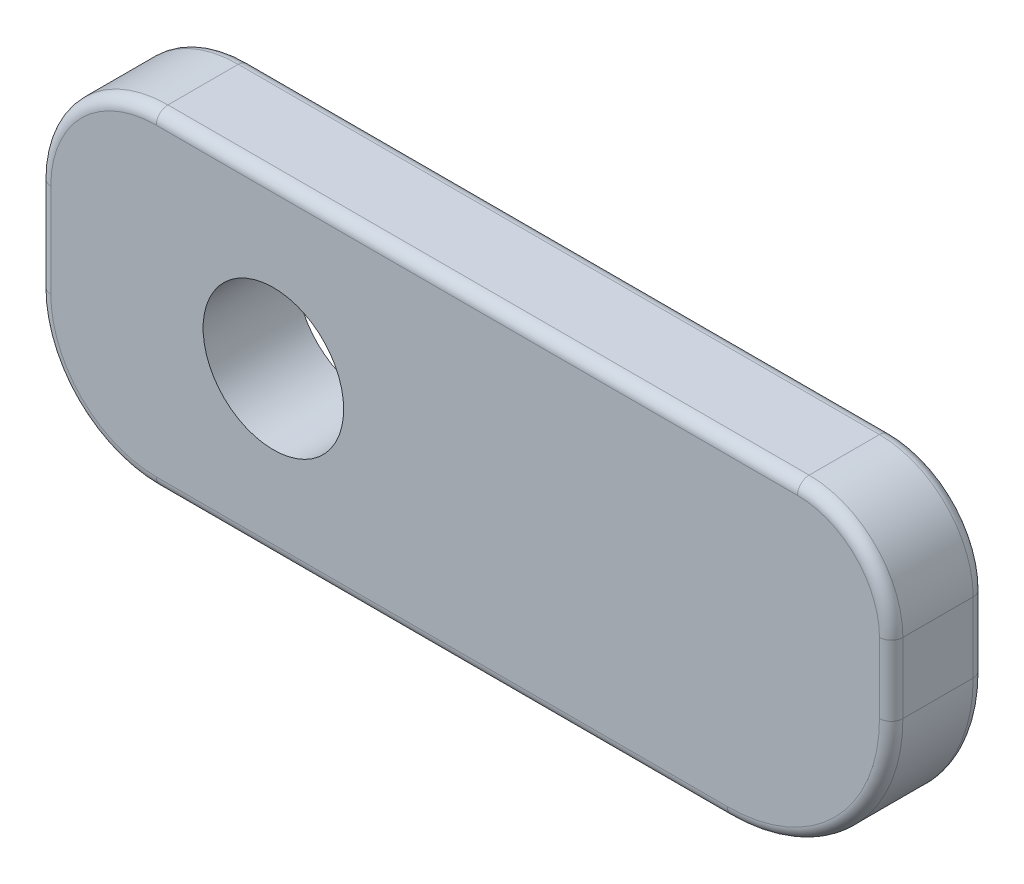
from build123d import *

# Parameters (mm, degrees)
SKETCH1_W           = 92.3798
SKETCH1_H           = 35.56
SKETCH1_R           = 7.62
BOSS_EXTRUDE1_DEPTH = 10.16
FILLET1_R           = 1.27
FILLET2_R           = 1.27
FILLET3_R           = 17.78
FILLET4_R           = 10.16
FILLET5_R           = 12.7
FILLET6_R           = 12.7


with BuildPart() as part:
    # Sketch1 → Boss-Extrude1 (new body)
    with BuildSketch(Plane.XY):
        with Locations((46.1899, 17.78)):
            Rectangle(SKETCH1_W, SKETCH1_H)
        with Locations((25.4, 17.78)):
            Circle(SKETCH1_R, mode=Mode.SUBTRACT)
    extrude(amount=BOSS_EXTRUDE1_DEPTH)

    # Fillet1
    fillet1_edges = [part.edges().sort_by_distance(p)[0] for p in [
        (46.1899, 35.56, 10.16),
        (0, 17.78, 10.16),
        (46.1899, 0, 10.16),
        (92.3798, 17.78, 10.16),
    ]]
    fillet(fillet1_edges, radius=FILLET1_R)

    # Fillet2
    fillet2_edges = [part.edges().sort_by_distance(p)[0] for p in [
        (0, 17.78, 0),
        (46.1899, 35.56, 0),
        (92.3798, 17.78, 0),
        (46.1899, 0, 0),
    ]]
    fillet(fillet2_edges, radius=FILLET2_R)

    # Fillet3
    # the kernel refuses this fillet: 17.78 mm, written as the material it takes off along each edge
    with BuildSketch(Plane(origin=(74.5998, 17.78, 10.16), x_dir=(0, -1, 0), z_dir=(-1, 0, 0))) as fillet3_piece_1:
        with BuildLine():
            CenterArc((16.51, -1.27), 1.27, 0, 90)
            Line((17.78, -1.27), (17.78, 0))
            Line((17.78, 0), (16.51, 0))
        make_face()
    revolve(axis=Axis((74.5998, 17.78, 10.16), (0, 0, 1)), revolution_arc=90, mode=Mode.SUBTRACT)
    with BuildSketch(Plane(origin=(74.5998, 17.78, 0), x_dir=(1, 0, 0), z_dir=(0, 1, 0))) as fillet3_piece_2:
        with BuildLine():
            CenterArc((16.51, -1.27), 1.27, 0, 90)
            Line((17.78, -1.27), (17.78, 0))
            Line((17.78, 0), (16.51, 0))
        make_face()
    revolve(axis=Axis((74.5998, 17.78, 0), (0, 0, -1)), revolution_arc=90, mode=Mode.SUBTRACT)
    with BuildSketch(Plane(origin=(92.3798, 0, 0), x_dir=(-1, 0, 0), z_dir=(0, 0, 1))) as fillet3_piece_3:
        with BuildLine():
            CenterArc((FILLET3_R, -FILLET3_R), FILLET3_R, 90, 90)
            Line((0, -FILLET3_R), (0, 0))
            Line((0, 0), (FILLET3_R, 0))
        make_face()
    extrude(amount=10.16, mode=Mode.SUBTRACT)

    # Fillet4
    # the kernel refuses this fillet: 10.16 mm, written as the material it takes off along each edge
    with BuildSketch(Plane(origin=(82.2198, 25.4, 10.16), x_dir=(1, 0, 0), z_dir=(0, -1, 0))) as fillet4_piece_1:
        with BuildLine():
            CenterArc((8.89, -1.27), 1.27, 0, 90)
            Line((10.16, -1.27), (10.16, 0))
            Line((10.16, 0), (8.89, 0))
        make_face()
    revolve(axis=Axis((82.2198, 25.4, 10.16), (0, 0, 1)), revolution_arc=90, mode=Mode.SUBTRACT)
    with BuildSketch(Plane(origin=(82.2198, 25.4, 0), x_dir=(0, 1, 0), z_dir=(-1, 0, 0))) as fillet4_piece_2:
        with BuildLine():
            CenterArc((8.89, -1.27), 1.27, 0, 90)
            Line((10.16, -1.27), (10.16, 0))
            Line((10.16, 0), (8.89, 0))
        make_face()
    revolve(axis=Axis((82.2198, 25.4, 0), (0, 0, -1)), revolution_arc=90, mode=Mode.SUBTRACT)
    with BuildSketch(Plane(origin=(92.3798, 35.56, 0), x_dir=(-1, 0, 0), z_dir=(0, 0, 1))) as fillet4_piece_3:
        with BuildLine():
            CenterArc((FILLET4_R, FILLET4_R), FILLET4_R, 180, 90)
            Line((0, FILLET4_R), (0, 0))
            Line((0, 0), (FILLET4_R, 0))
        make_face()
    extrude(amount=10.16, mode=Mode.SUBTRACT)

    # Fillet5
    # the kernel refuses this fillet: 12.7 mm, written as the material it takes off along each edge
    with BuildSketch(Plane(origin=(12.7, 22.86, 10.16), x_dir=(0, 1, 0), z_dir=(1, 0, 0))) as fillet5_piece_1:
        with BuildLine():
            CenterArc((11.43, -1.27), 1.27, 0, 90)
            Line((12.7, -1.27), (12.7, 0))
            Line((12.7, 0), (11.43, 0))
        make_face()
    revolve(axis=Axis((12.7, 22.86, 10.16), (0, 0, 1)), revolution_arc=90, mode=Mode.SUBTRACT)
    with BuildSketch(Plane(origin=(12.7, 22.86, 0), x_dir=(-1, 0, 0), z_dir=(0, -1, 0))) as fillet5_piece_2:
        with BuildLine():
            CenterArc((11.43, -1.27), 1.27, 0, 90)
            Line((12.7, -1.27), (12.7, 0))
            Line((12.7, 0), (11.43, 0))
        make_face()
    revolve(axis=Axis((12.7, 22.86, 0), (0, 0, -1)), revolution_arc=90, mode=Mode.SUBTRACT)
    with BuildSketch(Plane(origin=(0, 35.56, 0), x_dir=(0, -1, 0), z_dir=(0, 0, 1))) as fillet5_piece_3:
        with BuildLine():
            CenterArc((FILLET5_R, FILLET5_R), FILLET5_R, 180, 90)
            Line((0, FILLET5_R), (0, 0))
            Line((0, 0), (FILLET5_R, 0))
        make_face()
    extrude(amount=10.16, mode=Mode.SUBTRACT)

    # Fillet6
    # the kernel refuses this fillet: 12.7 mm, written as the material it takes off along each edge
    with BuildSketch(Plane(origin=(12.7, 12.7, 10.16), x_dir=(-1, 0, 0), z_dir=(0, 1, 0))) as fillet6_piece_1:
        with BuildLine():
            CenterArc((11.43, -1.27), 1.27, 0, 90)
            Line((12.7, -1.27), (12.7, 0))
            Line((12.7, 0), (11.43, 0))
        make_face()
    revolve(axis=Axis((12.7, 12.7, 10.16), (0, 0, 1)), revolution_arc=90, mode=Mode.SUBTRACT)
    with BuildSketch(Plane(origin=(12.7, 12.7, 0), x_dir=(0, -1, 0), z_dir=(1, 0, 0))) as fillet6_piece_2:
        with BuildLine():
            CenterArc((11.43, -1.27), 1.27, 0, 90)
            Line((12.7, -1.27), (12.7, 0))
            Line((12.7, 0), (11.43, 0))
        make_face()
    revolve(axis=Axis((12.7, 12.7, 0), (0, 0, -1)), revolution_arc=90, mode=Mode.SUBTRACT)
    with BuildSketch(Plane(origin=(0, 0, 0), x_dir=(0, 1, 0), z_dir=(0, 0, 1))) as fillet6_piece_3:
        with BuildLine():
            CenterArc((FILLET6_R, -FILLET6_R), FILLET6_R, 90, 90)
            Line((0, -FILLET6_R), (0, 0))
            Line((0, 0), (FILLET6_R, 0))
        make_face()
    extrude(amount=10.16, mode=Mode.SUBTRACT)


solid = part.part
